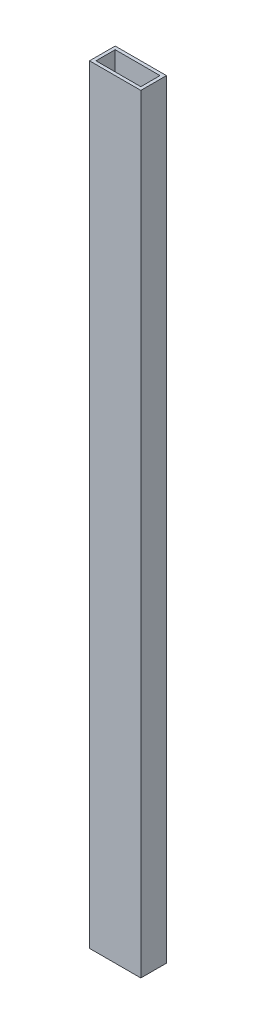
from build123d import *

# Parameters (mm, degrees)
SKETCH1_W           = 50.8
SKETCH1_H           = 25.4
SKETCH1_W_2         = 44.45
SKETCH1_H_2         = 19.05
BOSS_EXTRUDE1_DEPTH = 762


with BuildPart() as part:
    # Sketch1 → Boss-Extrude1 (new body)
    with BuildSketch(Plane(origin=(0, 0, 0), x_dir=(1, 0, 0), z_dir=(0, 1, 0))):
        Rectangle(SKETCH1_W, SKETCH1_H)
        Rectangle(SKETCH1_W_2, SKETCH1_H_2, mode=Mode.SUBTRACT)
    extrude(amount=BOSS_EXTRUDE1_DEPTH)


solid = part.part
